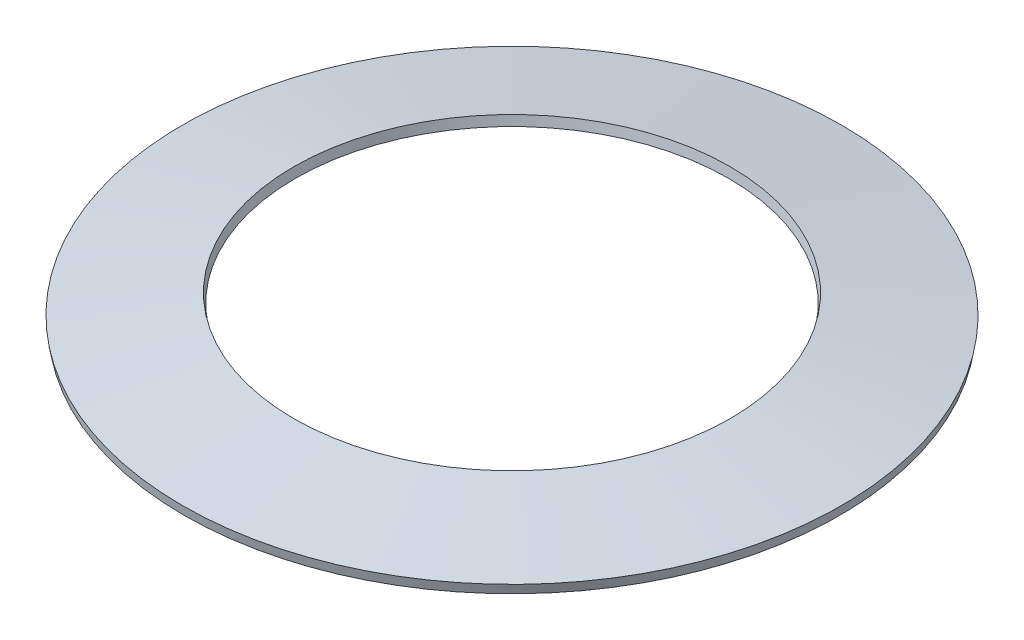
from build123d import *


with BuildPart() as part:
    # Esquisse1 → Base-Révolution (revolve)
    with BuildSketch(Plane.XY):
        Polygon((-34.826351822, 0), (-23, 2.08530491), (-23.173648178, 3.070112663), (-35, 0.984807753), align=None)
    revolve(axis=Axis((0, 0, 0), (0, 1, 0)))


solid = part.part
